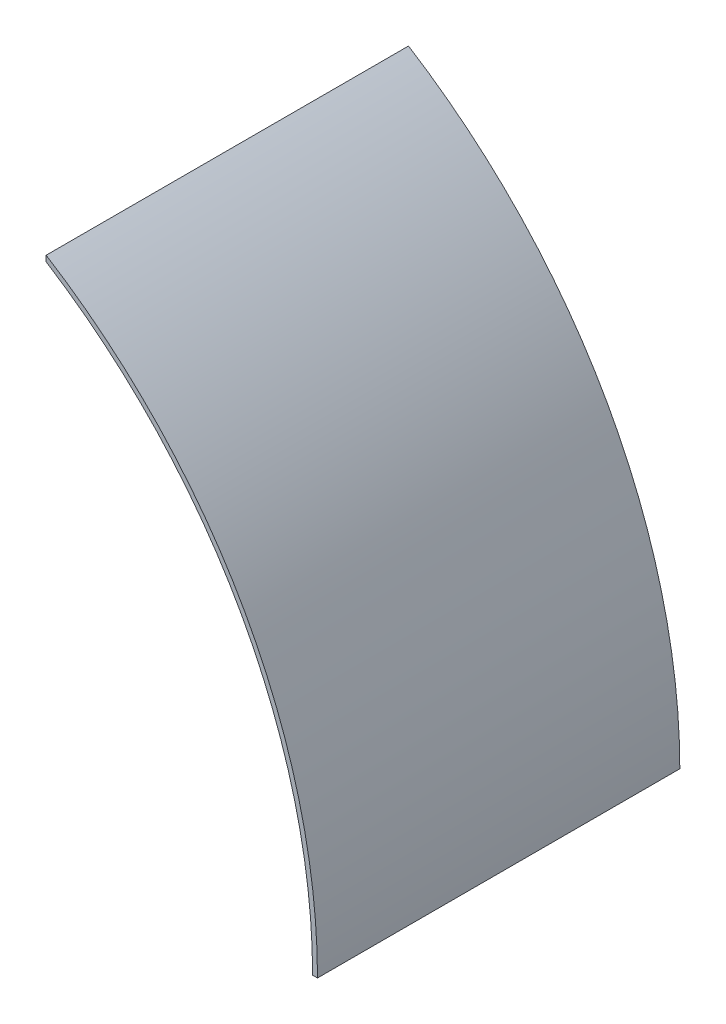
from build123d import *

# Parameters (mm, degrees)
INNER_RING_RIGHT_SIDE_DEPTH = 112.268


with BuildPart() as part:
    # Sketch2 → Inner Ring - Right Side (new body)
    with BuildSketch(Plane.XY):
        with BuildLine():
            Line((95.25, 151.929959422), (95.25, 150.134198303))
            ThreePointArc((95.25, 150.134198303), (155.801620659, 85.666183527), (177.8, 0))
            Line((177.8, 0), (179.31892, 0))
            ThreePointArc((179.31892, 0), (156.900290312, 86.819202772), (95.25, 151.929959422))
        make_face()
    extrude(amount=INNER_RING_RIGHT_SIDE_DEPTH)


solid = part.part
